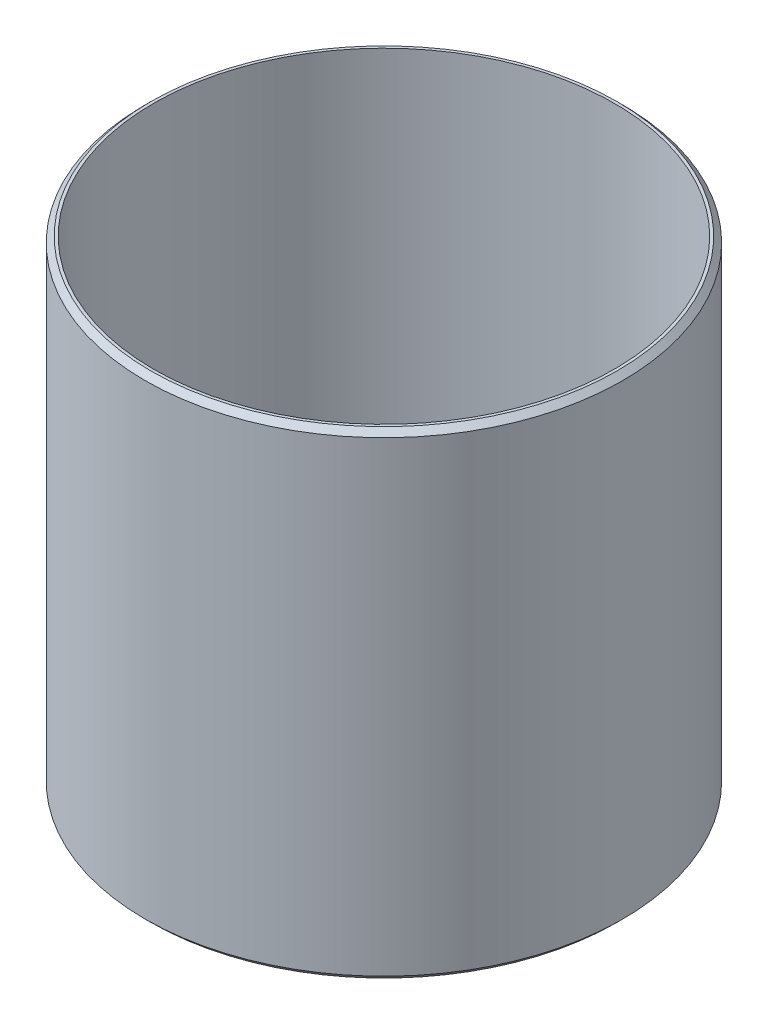
from build123d import *

# Parameters (mm, degrees)
SKETCH1_R           = 84.99983
SKETCH1_R_2         = 81.99983
BOSS_EXTRUDE1_DEPTH = 170
CHAMFER1_SIZE       = 2


with BuildPart() as part:
    # Sketch1 → Boss-Extrude1 (new body)
    with BuildSketch(Plane(origin=(0, 0, 0), x_dir=(1, 0, 0), z_dir=(0, 1, 0))):
        Circle(SKETCH1_R)
        Circle(SKETCH1_R_2, mode=Mode.SUBTRACT)
    extrude(amount=BOSS_EXTRUDE1_DEPTH)

    # Chamfer1
    chamfer1_edges = [part.edges().sort_by_distance(p)[0] for p in [
        (-84.99983, 0, 0),
        (-84.99983, 170, 0),
    ]]
    chamfer(chamfer1_edges, length=CHAMFER1_SIZE)


solid = part.part
